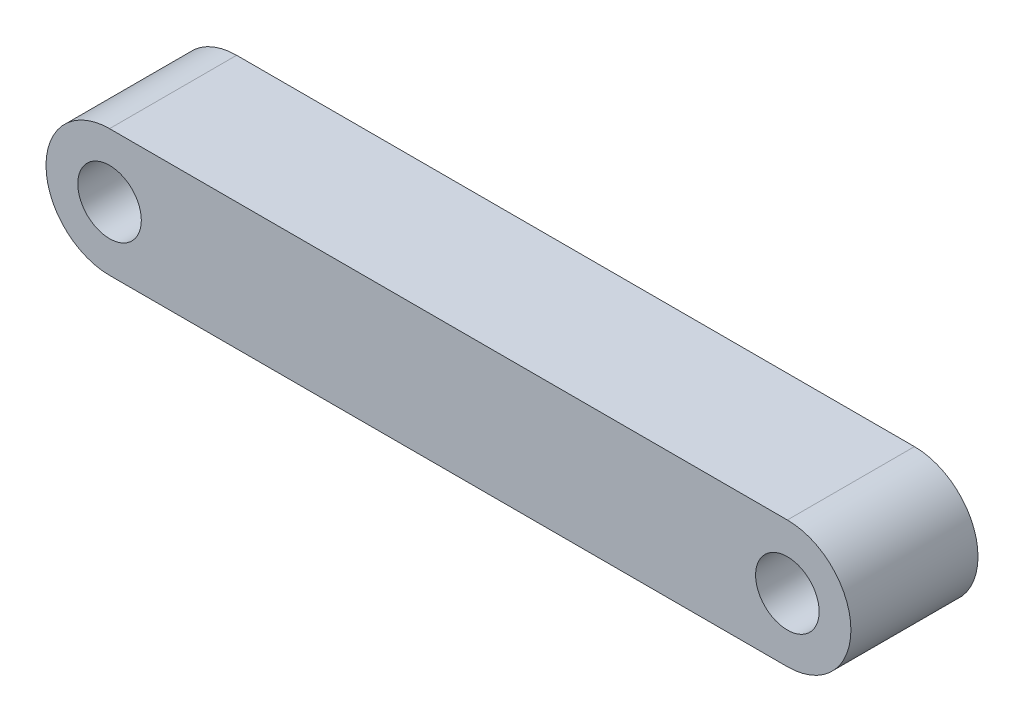
from build123d import *

# Parameters (mm, degrees)
BOSS_EXTRU_1_DEPTH      = 3
BOSS_EXTRU_1_DEPTH_BACK = 3
ESQUISSE1_R             = 1.5


with BuildPart() as part:
    # Esquisse1 → Boss.-Extru.1 (new, two sides: drawn at the far end of the back side and taken through both)
    with BuildSketch(Plane.XY.offset(-BOSS_EXTRU_1_DEPTH_BACK)):
        with BuildLine():
            Line((0, 3), (32, 3))
            ThreePointArc((32, 3), (35, 0), (32, -3))
            Line((32, -3), (0, -3))
            ThreePointArc((0, -3), (-3, 0), (0, 3))
        make_face()
        Circle(ESQUISSE1_R, mode=Mode.SUBTRACT)
        with Locations((32, 0)):
            Circle(ESQUISSE1_R, mode=Mode.SUBTRACT)
    extrude(amount=BOSS_EXTRU_1_DEPTH + BOSS_EXTRU_1_DEPTH_BACK)


solid = part.part
